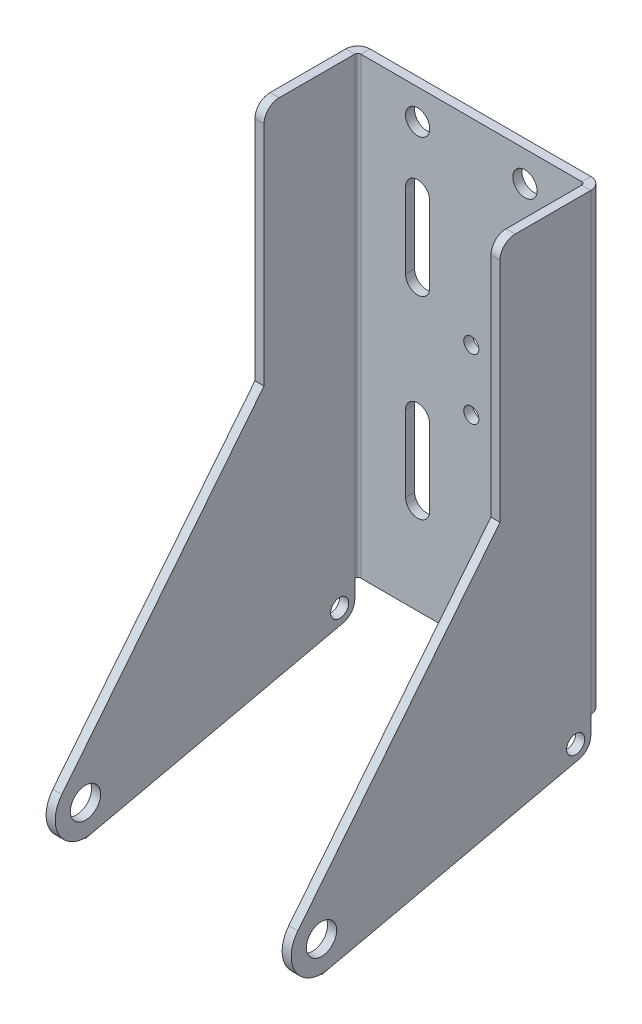
from build123d import *

# Parameters (mm, degrees)
SKETCH_1_W                       = 75
SKETCH_1_H                       = 180
SM_BASE_FLANGE_1_DEPTH           = 3
SM_EDGE_FLANGE_1_STRIP_W         = 14
SM_EDGE_FLANGE_1_STRIP_H         = 3
SM_EDGE_FLANGE_1_STRIP_CUT_DEPTH = 180
SM_EDGE_FLANGE_1_DEPTH           = 180
SM_EDGE_FLANGE_2_STRIP_W         = 14
SM_EDGE_FLANGE_2_STRIP_H         = 3
SM_EDGE_FLANGE_2_STRIP_CUT_DEPTH = 180
SM_EDGE_FLANGE_2_DEPTH           = 180
CUT_EXTRUDE_12_DEPTH             = 305
CUT_EXTRUDE_13_DEPTH             = 100
SKETCH_18_R                      = 5
CUT_EXTRUDE_14_DEPTH             = 100
CUT_EXTRUDE_16_DEPTH             = 100
SKETCH_21_W                      = 73
SKETCH_21_H                      = 30
CUT_EXTRUDE_17_DEPTH             = 100
CUT_EXTRUDE_18_DEPTH             = 4
CUT_EXTRUDE_START                = -4
CUT_EXTRUDE_19_DEPTH             = 4
SKETCH_24_R                      = 4
SKETCH_24_R_2                    = 2.5
CUT_EXTRUDE_20_DEPTH             = 195.569908194
CUT_EXTRUDE_23_DEPTH             = 4
SKETCH_26_W                      = 5.11266932
SKETCH_26_H                      = 10
CUT_EXTRUDE_24_DEPTH             = 4
FILLET_1_R                       = 5
FILLET_2_R                       = 5
FILLET_3_R                       = 5
FILLET_4_R                       = 5
SKETCH_27_R                      = 3
CUT_EXTRUDE_25_DEPTH             = 202.049602951


# Read off the part's stored shape, not the designer's step: 切除-拉伸19
# Sheet-metal steps are written as plain solids
with BuildPart() as part:
    # Sketch 1 → 基体-法兰1 (new body)
    with BuildSketch(Plane.XY):
        with Locations((17.710878089, -64.466639915)):
            Rectangle(SKETCH_1_W, SKETCH_1_H)
    extrude(amount=-SM_BASE_FLANGE_1_DEPTH)

    # 边线-法兰1 strip (across the edge) → 边线-法兰1 strip cut (cut)
    with BuildSketch(Plane(origin=(55.210878089, -154.466639915, 0), x_dir=(-1, 0, 0), z_dir=(0, 1, 0))):
        with Locations((-6, -1.5)):
            Rectangle(SM_EDGE_FLANGE_1_STRIP_W, SM_EDGE_FLANGE_1_STRIP_H)
    extrude(amount=SM_EDGE_FLANGE_1_STRIP_CUT_DEPTH, mode=Mode.SUBTRACT)

    # 边线-法兰1 section (across the edge) → 边线-法兰1 (add)
    with BuildSketch(Plane(origin=(55.210878089, -154.466639915, 0), x_dir=(-1, 0, 0), z_dir=(0, 1, 0))):
        with BuildLine():
            Line((-3, 1), (-3, 100))
            Line((-3, 100), (0, 100))
            Line((0, 100), (0, 1))
            ThreePointArc((0, 1), (0.292893219, 0.292893219), (1, 0))
            Line((1, 0), (1, -3))
            ThreePointArc((1, -3), (-1.828427125, -1.828427125), (-3, 1))
        make_face()
    extrude(amount=SM_EDGE_FLANGE_1_DEPTH)

    # 边线-法兰2 strip (across the edge) → 边线-法兰2 strip cut (cut)
    with BuildSketch(Plane(origin=(-19.789121911, 25.533360085, 0), x_dir=(1, 0, 0), z_dir=(0, -1, 0))):
        with Locations((-6, -1.5)):
            Rectangle(SM_EDGE_FLANGE_2_STRIP_W, SM_EDGE_FLANGE_2_STRIP_H)
    extrude(amount=SM_EDGE_FLANGE_2_STRIP_CUT_DEPTH, mode=Mode.SUBTRACT)

    # 边线-法兰2 section (across the edge) → 边线-法兰2 (add)
    with BuildSketch(Plane(origin=(-19.789121911, 25.533360085, 0), x_dir=(1, 0, 0), z_dir=(0, -1, 0))):
        with BuildLine():
            Line((-3, 1), (-3, 100))
            Line((-3, 100), (0, 100))
            Line((0, 100), (0, 1))
            ThreePointArc((0, 1), (0.292893219, 0.292893219), (1, 0))
            Line((1, 0), (1, -3))
            ThreePointArc((1, -3), (-1.828427125, -1.828427125), (-3, 1))
        make_face()
    extrude(amount=SM_EDGE_FLANGE_2_DEPTH)

    # 草图15 → 切除-拉伸12 (cut)
    with BuildSketch(Plane(origin=(58.210878089, 0, 0), x_dir=(0, 0, -1), z_dir=(1, 0, 0))):
        Polygon((-1, -154.466639915), (-1, -134.466639915), (-90, -154.466639915), align=None)
    extrude(amount=-CUT_EXTRUDE_12_DEPTH, mode=Mode.SUBTRACT)

    # 草图17 → 切除-拉伸13 (cut)
    with BuildSketch(Plane(origin=(58.210878089, 0, 0), x_dir=(0, 0, -1), z_dir=(1, 0, 0))):
        with BuildLine():
            Line((-100, -144.217256156), (-100, -154.466639915))
            Line((-100, -154.466639915), (-90, -154.466639915))
            Line((-90, -154.466639915), (-87.840693161, -153.981343107))
            ThreePointArc((-87.840693161, -153.981343107), (-96.261267109, -152.014469389), (-100, -144.217256156))
        make_face()
    extrude(amount=-CUT_EXTRUDE_13_DEPTH, mode=Mode.SUBTRACT)

    # 草图18 → 切除-拉伸14 (cut)
    with BuildSketch(Plane(origin=(58.210878089, 0, 0), x_dir=(0, 0, -1), z_dir=(1, 0, 0))):
        with Locations((-90, -144.217256156)):
            Circle(SKETCH_18_R)
    extrude(amount=-CUT_EXTRUDE_14_DEPTH, mode=Mode.SUBTRACT)

    # 草图19 → 切除-拉伸16 (cut)
    with BuildSketch(Plane(origin=(58.210878089, 0, 0), x_dir=(0, 0, -1), z_dir=(1, 0, 0))):
        with BuildLine():
            ThreePointArc((-100, -144.217256156), (-99.436213635, -140.906988458), (-97.808425553, -137.969977518))
            Line((-97.808425553, -137.969977518), (-31, -54.466639915))
            Line((-31, -54.466639915), (-31, 25.533360085))
            Line((-31, 25.533360085), (-100, 25.533360085))
            Line((-100, 25.533360085), (-100, -144.217256156))
        make_face()
    extrude(amount=-CUT_EXTRUDE_16_DEPTH, mode=Mode.SUBTRACT)

    # 草图21 → 切除-拉伸17 (cut)
    with BuildSketch(Plane(origin=(0, 0, -3), x_dir=(-1, 0, 0), z_dir=(0, 0, -1))):
        with Locations((-17.710878089, -139.466639915)):
            Rectangle(SKETCH_21_W, SKETCH_21_H)
    extrude(amount=-CUT_EXTRUDE_17_DEPTH, mode=Mode.SUBTRACT)

    # 草图22 → 切除-拉伸18 (cut)
    with BuildSketch(Plane(origin=(0, 0, -3), x_dir=(-1, 0, 0), z_dir=(0, 0, -1))):
        Polygon((-59.141267928, -134.466639915), (-53.468887504, -134.466639915), (-53.468887504, -154.535826818), (-59.141267928, -156.162456052), align=None)
    extrude(amount=-CUT_EXTRUDE_18_DEPTH, mode=Mode.SUBTRACT)

    # 切除-拉伸19 outline → 切除-拉伸19 (cut)
    with BuildSketch(Plane(origin=(-18.789121911, 0, 0), x_dir=(0, 0, -1), z_dir=(1, 0, 0)).offset(CUT_EXTRUDE_START)):
        Polygon((3, -154.466639915), (4.115118774, -134.466639915), (-1, -134.466639915), (-1, -154.466639915), align=None)
    extrude(amount=CUT_EXTRUDE_19_DEPTH, mode=Mode.SUBTRACT)

    # 草图24 → 切除-拉伸20 (cut, through all)
    with BuildSketch(Plane(origin=(0, 0, -3), x_dir=(-1, 0, 0), z_dir=(0, 0, -1))):
        with Locations((-35.446317978, 15.533360085)):
            Circle(SKETCH_24_R)
        with Locations(Location((0.0245618, 15.533360085, 0), (0, 0, 180))):
            Circle(SKETCH_24_R)
        with Locations((-17.710878089, -39.466639915)):
            Circle(SKETCH_24_R_2)
        with Locations(Location((-17.710878089, -59.466639915, 0), (0, 0, 180))):
            Circle(SKETCH_24_R_2)
        with BuildLine():
            Line((-31.446317978, -5.021559832), (-31.446317978, -30.021559832))
            ThreePointArc((-31.446317978, -30.021559832), (-35.446317978, -34.021559832), (-39.446317978, -30.021559832))
            Line((-39.446317978, -30.021559832), (-39.446317978, -5.021559832))
            ThreePointArc((-39.446317978, -5.021559832), (-35.446317978, -1.021559832), (-31.446317978, -5.021559832))
        make_face()
        with BuildLine():
            Line((-3.9754382, -5.021559832), (-3.9754382, -30.021559832))
            ThreePointArc((-3.9754382, -30.021559832), (0.0245618, -34.021559832), (4.0245618, -30.021559832))
            Line((4.0245618, -30.021559832), (4.0245618, -5.021559832))
            ThreePointArc((4.0245618, -5.021559832), (0.0245618, -1.021559832), (-3.9754382, -5.021559832))
        make_face()
        with BuildLine():
            Line((-31.446317978, -93.911719998), (-31.446317978, -68.911719998))
            ThreePointArc((-31.446317978, -68.911719998), (-35.446317978, -64.911719998), (-39.446317978, -68.911719998))
            Line((-39.446317978, -68.911719998), (-39.446317978, -93.911719998))
            ThreePointArc((-39.446317978, -93.911719998), (-35.446317978, -97.911719998), (-31.446317978, -93.911719998))
        make_face()
        with BuildLine():
            Line((-3.9754382, -93.911719998), (-3.9754382, -68.911719998))
            ThreePointArc((-3.9754382, -68.911719998), (0.0245618, -64.911719998), (4.0245618, -68.911719998))
            Line((4.0245618, -68.911719998), (4.0245618, -93.911719998))
            ThreePointArc((4.0245618, -93.911719998), (0.0245618, -97.911719998), (-3.9754382, -93.911719998))
        make_face()
    extrude(amount=-CUT_EXTRUDE_20_DEPTH, mode=Mode.SUBTRACT)

    # 草图25 → 切除-拉伸23 (cut)
    with BuildSketch(Plane(origin=(0, 0, -3), x_dir=(-1, 0, 0), z_dir=(0, 0, -1))):
        Polygon((-54.27524735, -124.441494169), (-58.427773386, -124.441494169), (-58.210878089, -134.466639915), (-55.210878089, -134.466639915), (-54.27524735, -134.466639915), (-52.445155018, -134.466639915), (-52.445155018, -124.466639915), align=None)
    extrude(amount=-CUT_EXTRUDE_23_DEPTH, mode=Mode.SUBTRACT)

    # 草图26 → 切除-拉伸24 (cut)
    with BuildSketch(Plane(origin=(0, 0, -3), x_dir=(-1, 0, 0), z_dir=(0, 0, -1))):
        with Locations((21.345456571, -129.466639915)):
            Rectangle(SKETCH_26_W, SKETCH_26_H)
    extrude(amount=-CUT_EXTRUDE_24_DEPTH, mode=Mode.SUBTRACT)

    # 圆角1
    fillet_1_edges = [part.edges().sort_by_distance(p)[0] for p in [
        (56.710878089, -134.466639915, 1),
    ]]
    fillet(fillet_1_edges, radius=FILLET_1_R)

    # 圆角2
    fillet_2_edges = [part.edges().sort_by_distance(p)[0] for p in [
        (-21.289121911, -134.466639915, 1),
    ]]
    fillet(fillet_2_edges, radius=FILLET_2_R)

    # 圆角3
    fillet_3_edges = [part.edges().sort_by_distance(p)[0] for p in [
        (56.710878089, 25.533360085, 31),
    ]]
    fillet(fillet_3_edges, radius=FILLET_3_R)

    # 圆角4
    fillet_4_edges = [part.edges().sort_by_distance(p)[0] for p in [
        (-21.289121911, 25.533360085, 31),
    ]]
    fillet(fillet_4_edges, radius=FILLET_4_R)

    # 草图27 → 切除-拉伸25 (cut, through all)
    with BuildSketch(Plane(origin=(58.210878089, 0, 0), x_dir=(0, 0, -1), z_dir=(1, 0, 0))):
        with Locations((-6, -130.465543541)):
            Circle(SKETCH_27_R)
    extrude(amount=-CUT_EXTRUDE_25_DEPTH, mode=Mode.SUBTRACT)


solid = part.part
